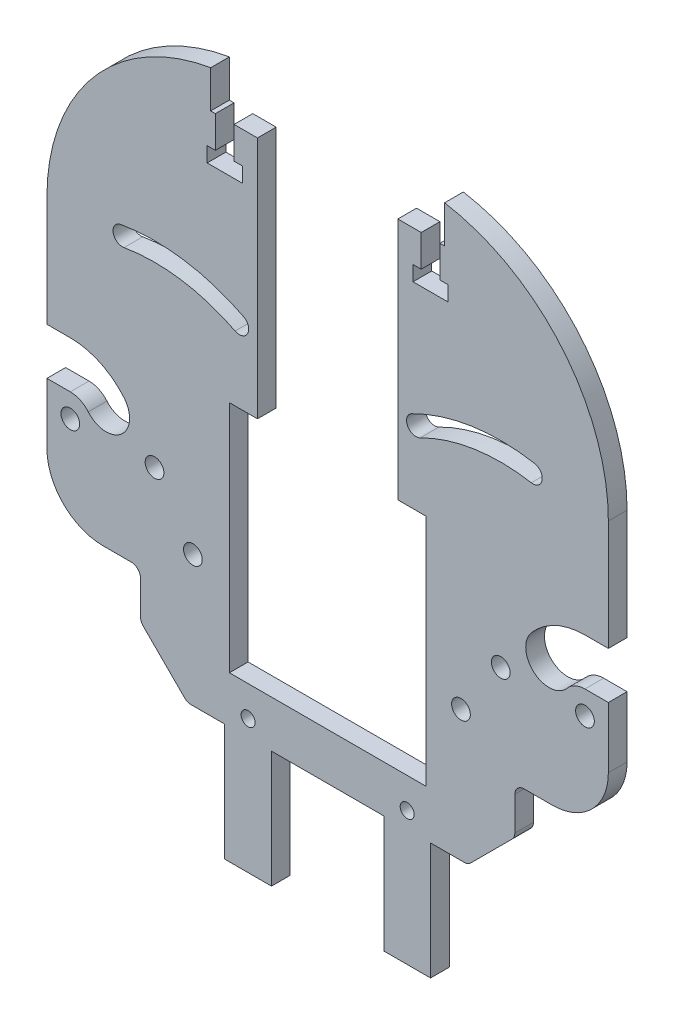
from build123d import *

# Parameters (mm, degrees)
BOSS_EXTRUDE1_DEPTH = 4
SKETCH2_R           = 2
SKETCH2_R_2         = 1.5
CUT_EXTRUDE1_DEPTH  = 95.026591983
SKETCH4_W           = 20
SKETCH4_H           = 100
BOSS_EXTRUDE2_DEPTH = 4
FILLET3_R           = 42
FILLET4_R           = 12
SKETCH7_R           = 2
CUT_EXTRUDE3_DEPTH  = 105.120122935
CHAMFER1_SIZE       = 10
FILLET8_R           = 2
CUT_EXTRUDE4_DEPTH  = 105.120122935
CUT_EXTRUDE5_DEPTH  = 105.120122935
SKETCH10_R          = 2
CUT_EXTRUDE6_DEPTH  = 105.120122935


with BuildPart() as part:
    # Sketch1 → Boss-Extrude1 (new body)
    with BuildSketch(Plane.XY):
        Polygon((-40, 60), (-25, 60), (-25, 52), (-15, 52), (-15, 0), (-21, 0), (-21, -50), (21, -50), (21, 0), (15, 0), (15, 52), (25, 52), (25, 60), (40, 60), (40, -60), (22, -60), (22, -85), (12, -85), (12, -60), (-12, -60), (-12, -85), (-22, -85), (-22, -60), (-40, -60), align=None)
    extrude(amount=BOSS_EXTRUDE1_DEPTH)

    # Sketch2 → Cut-Extrude1 (cut, through all)
    with BuildSketch(Plane(origin=(0, 0, 0), x_dir=(-1, 0, 0), z_dir=(0, 0, -1))):
        with Locations((-28.5, -32)):
            Circle(SKETCH2_R)
        with Locations((17, -56.5)):
            Circle(SKETCH2_R_2)
        with Locations((28.8, -32)):
            Circle(SKETCH2_R)
        with Locations((-17, -56.5)):
            Circle(SKETCH2_R_2)
    extrude(amount=-CUT_EXTRUDE1_DEPTH, mode=Mode.SUBTRACT)

    # Sketch4 → Boss-Extrude2 (add)
    with BuildSketch(Plane.XY.offset(4)):
        with Locations((-50, 10)):
            Rectangle(SKETCH4_W, SKETCH4_H)
        with Locations((50, 10)):
            Rectangle(SKETCH4_W, SKETCH4_H)
    extrude(amount=-BOSS_EXTRUDE2_DEPTH)

    # Fillet3
    # the kernel refuses this fillet: 42 mm, written as the material it takes off along each edge
    with BuildSketch(Plane(origin=(60, 60, 107.531396204), x_dir=(0, -1, 0), z_dir=(0, 0, -1))) as fillet3_piece_1:
        with BuildLine():
            CenterArc((41.412558482, 42), FILLET3_R, 189.594068227, 80.405931773)
            Line((0, 35), (-0.82825117, 34.86))
            ThreePointArc((-0.82825117, 34.86), (-0.84, 17.5), (-0.84, 0))
            Line((-0.84, 0), (0, -0.84))
            Line((0, -0.84), (41.412558482, -0.84))
            Line((41.412558482, -0.84), (41.412558482, 0))
        make_face()
    extrude(amount=211.062792409, mode=Mode.SUBTRACT)
    with BuildSketch(Plane(origin=(-60, 60, 107.531396204), x_dir=(1, 0, 0), z_dir=(0, 0, -1))) as fillet3_piece_2:
        with BuildLine():
            CenterArc((42, 41.412558482), FILLET3_R, 180, 80.405931773)
            Line((0, 41.412558482), (-0.84, 41.412558482))
            Line((-0.84, 41.412558482), (-0.84, 0))
            Line((-0.84, 0), (0, -0.84))
            ThreePointArc((0, -0.84), (17.5, -0.84), (34.86, -0.82825117))
            Line((34.86, -0.82825117), (35, 0))
        make_face()
    extrude(amount=211.062792409, mode=Mode.SUBTRACT)

    # Fillet4
    fillet4_edges = [part.edges().sort_by_distance(p)[0] for p in [
        (60, -40, 2),
        (-60, -40, 2),
    ]]
    fillet(fillet4_edges, radius=FILLET4_R)

    # Sketch7 → Cut-Extrude3 (cut, through all)
    with BuildSketch(Plane.XY):
        with Locations(Location((-55, -20, 0), (0, 0, 180))):
            Circle(SKETCH7_R)
        with Locations(Location((55, -20, 0), (0, 0, 180))):
            Circle(SKETCH7_R)
        with Locations(Location((-37, -20, 0), (0, 0, 180))):
            Circle(SKETCH7_R)
        with Locations(Location((37, -20, 0), (0, 0, 180))):
            Circle(SKETCH7_R)
    extrude(amount=CUT_EXTRUDE3_DEPTH, mode=Mode.SUBTRACT)

    # Chamfer1
    chamfer1_edges = [part.edges().sort_by_distance(p)[0] for p in [
        (-40, -60, 2),
        (40, -60, 2),
    ]]
    chamfer(chamfer1_edges, length=CHAMFER1_SIZE)

    # Fillet8
    fillet8_edges = [part.edges().sort_by_distance(p)[0] for p in [
        (-30, -60, 2),
        (-40, -50, 2),
        (30, -60, 2),
        (40, -50, 2),
        (40, -40, 2),
        (-40, -40, 2),
    ]]
    fillet(fillet8_edges, radius=FILLET8_R)

    # Sketch8 → Cut-Extrude4 (cut, through all)
    with BuildSketch(Plane(origin=(0, 0, 0), x_dir=(-1, 0, 0), z_dir=(0, 0, -1))):
        with BuildLine():
            ThreePointArc((-17.964817996, 17.438774634), (-30.770630407, 21.535466224), (-44.214817996, 21.375674028))
            ThreePointArc((-44.214817996, 21.375674028), (-45.841525426, 19.061841075), (-43.527692473, 17.435133644))
            ThreePointArc((-43.527692473, 17.435133644), (-31.363903701, 17.579707536), (-19.777692473, 13.87317705))
            ThreePointArc((-19.777692473, 13.87317705), (-17.088456442, 14.749538603), (-17.964817996, 17.438774634))
        make_face()
        with BuildLine():
            ThreePointArc((17.964817996, 17.438774634), (30.770630407, 21.535466224), (44.214817996, 21.375674028))
            ThreePointArc((44.214817996, 21.375674028), (45.841525426, 19.061841075), (43.527692473, 17.435133644))
            ThreePointArc((43.527692473, 17.435133644), (31.363903701, 17.579707536), (19.777692473, 13.87317705))
            ThreePointArc((19.777692473, 13.87317705), (17.088456442, 14.749538603), (17.964817996, 17.438774634))
        make_face()
    extrude(amount=-CUT_EXTRUDE4_DEPTH, mode=Mode.SUBTRACT)

    # Sketch9 → Cut-Extrude5 (cut, through all)
    with BuildSketch(Plane.XY.offset(4)):
        Polygon((-24, 52), (-20, 52), (-20, 45.2), (-18.25, 45.2), (-18.25, 42), (-25.75, 42), (-25.75, 45.2), (-24, 45.2), align=None)
    cut_extrude5 = extrude(amount=-CUT_EXTRUDE5_DEPTH, mode=Mode.SUBTRACT)

    # Mirror1: Cut-Extrude5 across plane
    add(cut_extrude5.mirror(Plane(origin=(0, 0, 0), x_dir=(0, 0, 1), z_dir=(1, 0, 0))), mode=Mode.SUBTRACT)

    # Sketch10 → Cut-Extrude6 (cut, through all)
    with BuildSketch(Plane.XY.offset(4)):
        with Locations(Location((55, -20, 0), (0, 0, 180))):
            Circle(SKETCH10_R)
        with BuildLine():
            Line((55, -5), (60, -5))
            Line((60, -5), (60, -15))
            Line((60, -15), (55, -15))
            ThreePointArc((55, -15), (52.886908691, -15.468461065), (51.169777784, -16.786061952))
            ThreePointArc((51.169777784, -16.786061952), (44.12561752, -17.402346119), (43.509333353, -10.358185855))
            ThreePointArc((43.509333353, -10.358185855), (48.660726074, -6.405383194), (55, -5))
        make_face()
    cut_extrude6 = extrude(amount=-CUT_EXTRUDE6_DEPTH, mode=Mode.SUBTRACT)

    # Mirror2: Cut-Extrude6 across plane
    add(cut_extrude6.mirror(Plane(origin=(0, 0, 0), x_dir=(0, 0, 1), z_dir=(1, 0, 0))), mode=Mode.SUBTRACT)


solid = part.part
